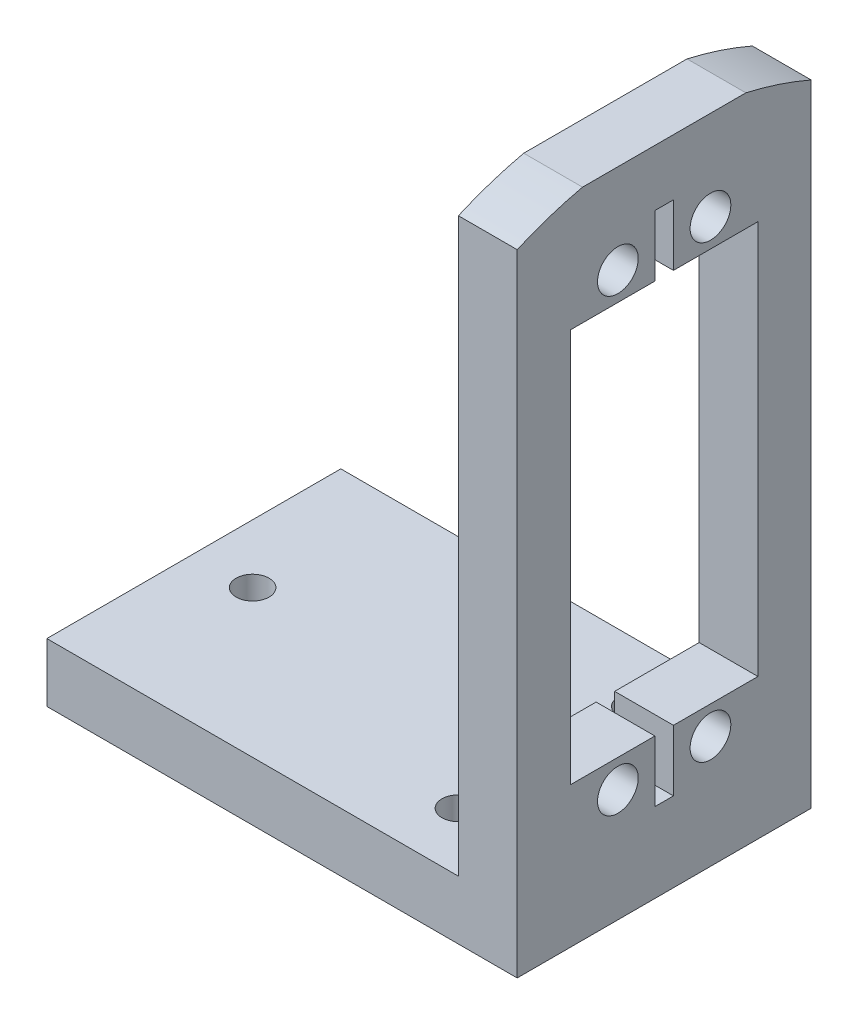
from build123d import *

# Parameters (mm, degrees)
SKETCH3_W           = 31.75
SKETCH3_H           = 64.09500008
SKETCH3_R           = 2.200000045
BOSS_EXTRUDE1_DEPTH = 6.35
SKETCH5_W           = 31.75
SKETCH5_H           = 6.35
BOSS_EXTRUDE2_DEPTH = 50.8
SKETCH6_R           = 1.777000002
CUT_EXTRUDE1_DEPTH  = 85.214215161
CUT_EXTRUDE2_DEPTH  = 88.731815981


with BuildPart() as part:
    # Sketch3 → Boss-Extrude1 (new body)
    with BuildSketch(Plane(origin=(0, 0, 0), x_dir=(0, 0, -1), z_dir=(1, 0, 0))):
        with Locations((15.875, 32.04750004)):
            Rectangle(SKETCH3_W, SKETCH3_H)
        with Locations((10.874999967, 5.822500039)):
            Circle(SKETCH3_R, mode=Mode.SUBTRACT)
        with Locations((20.875000033, 5.822500039)):
            Circle(SKETCH3_R, mode=Mode.SUBTRACT)
        with Locations((10.874999967, 54.422500121)):
            Circle(SKETCH3_R, mode=Mode.SUBTRACT)
        with Locations((20.875000033, 54.422500121)):
            Circle(SKETCH3_R, mode=Mode.SUBTRACT)
        Polygon((5.748000061, 51.39500008), (14.875, 51.39500008), (14.875, 57.99900008), (16.875, 57.99900008), (16.875, 51.39500008), (26.001999939, 51.39500008), (26.001999939, 8.85000008), (16.875, 8.85000008), (16.875, 2.24600008), (14.875, 2.24600008), (14.875, 8.85000008), (5.748000061, 8.85000008), align=None, mode=Mode.SUBTRACT)
    extrude(amount=BOSS_EXTRUDE1_DEPTH)

    # Sketch5 → Boss-Extrude2 (add)
    with BuildSketch(Plane(origin=(6.35, 0, 0), x_dir=(0, 0, -1), z_dir=(1, 0, 0))):
        with Locations((15.875, -3.175)):
            Rectangle(SKETCH5_W, SKETCH5_H)
    extrude(amount=-BOSS_EXTRUDE2_DEPTH)

    # Sketch6 → Cut-Extrude1 (cut, through all)
    with BuildSketch(Plane(origin=(0, 0, 0), x_dir=(1, 0, 0), z_dir=(0, 1, 0))):
        with Locations((-6.35, 6.35)):
            Circle(SKETCH6_R)
        with Locations((-38.1, 15.875)):
            Circle(SKETCH6_R)
        with Locations((-6.35, 25.4)):
            Circle(SKETCH6_R)
    extrude(amount=-CUT_EXTRUDE1_DEPTH, mode=Mode.SUBTRACT)

    # Sketch7 → Cut-Extrude2 (cut, through all)
    with BuildSketch(Plane(origin=(6.35, 0, 0), x_dir=(0, 0, -1), z_dir=(1, 0, 0))):
        with BuildLine():
            Line((0, 61.774194579), (0, 82.748877538))
            Line((0, 82.748877538), (31.75, 82.748877538))
            Line((31.75, 82.748877538), (31.75, 61.774194579))
            ThreePointArc((31.75, 61.774194579), (15.875, 65.0875), (0, 61.774194579))
        make_face()
    extrude(amount=-CUT_EXTRUDE2_DEPTH, mode=Mode.SUBTRACT)


solid = part.part
